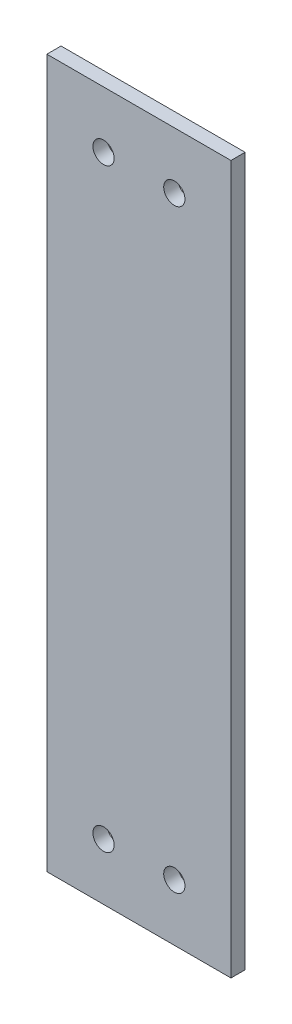
from build123d import *

# Parameters (mm, degrees)
SKETCH_1_W      = 26
SKETCH_1_H      = 100
SKETCH_1_R      = 1.5
EXTRUDE_1_DEPTH = 2


with BuildPart() as part:
    # Эскиз1 → Бобышка-Вытянуть1 (new body)
    with BuildSketch(Plane.XY):
        with Locations((13, 50)):
            Rectangle(SKETCH_1_W, SKETCH_1_H)
        with Locations((8, 8)):
            Circle(SKETCH_1_R, mode=Mode.SUBTRACT)
        with Locations((18, 8)):
            Circle(SKETCH_1_R, mode=Mode.SUBTRACT)
        with Locations((18, 92)):
            Circle(SKETCH_1_R, mode=Mode.SUBTRACT)
        with Locations((8, 92)):
            Circle(SKETCH_1_R, mode=Mode.SUBTRACT)
    extrude(amount=EXTRUDE_1_DEPTH)


solid = part.part
